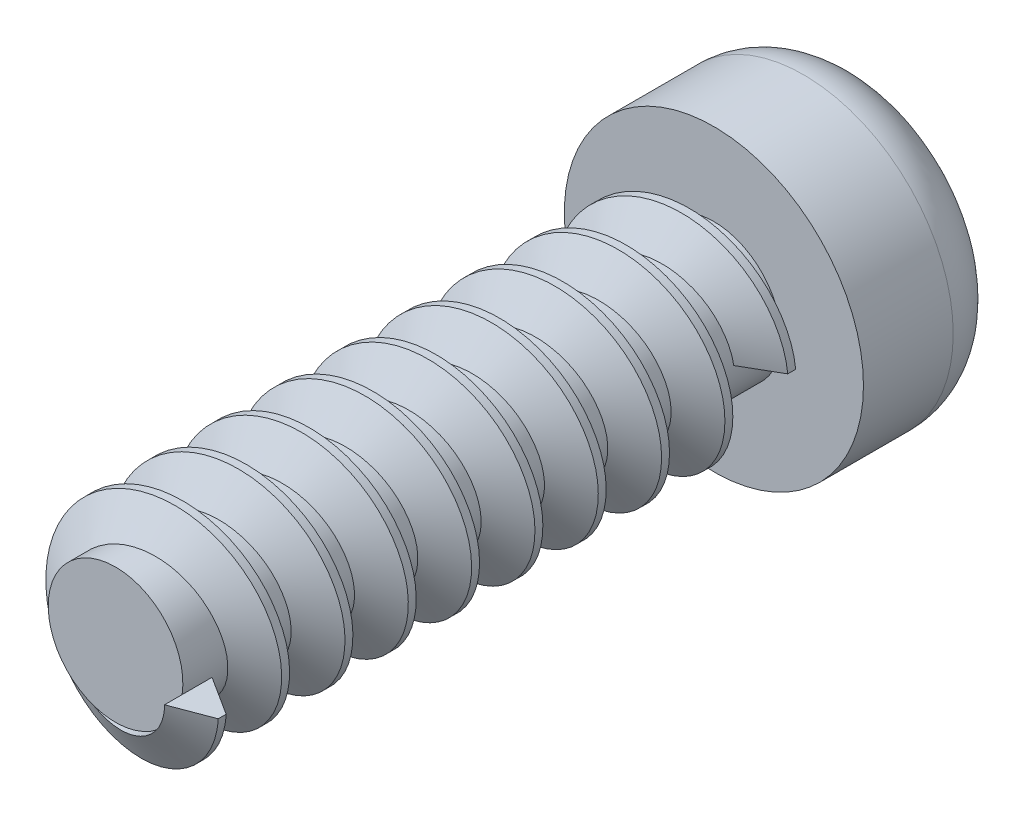
from build123d import *

# Parameters (mm, degrees)
SKETCH1_R           = 5
BOSS_EXTRUDE1_DEPTH = 5
SKETCH2_R           = 2.25
BOSS_EXTRUDE2_DEPTH = 20
THREAD1_PITCH       = 2.116666667
FILLET1_R           = 2


with BuildPart() as part:
    # Sketch1 → Boss-Extrude1 (new body)
    with BuildSketch(Plane.XY):
        Circle(SKETCH1_R)
    extrude(amount=BOSS_EXTRUDE1_DEPTH)

    # Sketch2 → Boss-Extrude2 (add)
    with BuildSketch(Plane.XY.offset(5)):
        Circle(SKETCH2_R)
    extrude(amount=BOSS_EXTRUDE2_DEPTH)

    # Thread1: the profile of Thread Profile1 profile screwed along a right-hand helix of 8.976378 turns, 10 arcs to a turn; built about Z, then put on its axis
    thread1_z = Axis((0, 0, 0), (0, 0, 1))
    thread1_corners = [(2.2497, 0, -0.000173205), (3.395679435, 0, 0.66145833), (3.395679435, 0, 0.926041664), (2.2497, 0, 1.587673199)]
    with BuildLine(mode=Mode.PRIVATE) as thread1_profile:
        Line(thread1_corners[0], thread1_corners[1])
        Line(thread1_corners[1], thread1_corners[2])
        Line(thread1_corners[2], thread1_corners[3])
        Line(thread1_corners[3], thread1_corners[0])
    thread1_cap = Face(thread1_profile.wire())
    thread1_turn_angles = [0, 18, 36, 54, 72, 90, 108, 126, 144, 162, 180, 198, 216, 234, 252, 270, 288, 306, 324, 342, 360]
    thread1_turn_weights = [1, 0.9510565162951535, 1, 0.9510565162951535, 1, 0.9510565162951535, 1, 0.9510565162951535, 1, 0.9510565162951535, 1, 0.9510565162951535, 1, 0.9510565162951535, 1, 0.9510565162951535, 1, 0.9510565162951535, 1, 0.9510565162951535, 1]
    thread1_turn_rails = [Edge.make_bspline([Vector(p[0], p[1], 0).rotate(thread1_z, thread1_turn_angles[k]) / thread1_turn_weights[k] + Vector(0, 0, p[2] + THREAD1_PITCH * thread1_turn_angles[k] / 360) for k in range(21)], [0, 0, 0, 1, 1, 2, 2, 3, 3, 4, 4, 5, 5, 6, 6, 7, 7, 8, 8, 9, 9, 10, 10, 10], 2, thread1_turn_weights) for p in thread1_corners]
    thread1_turn_sides = [Face.make_surface_from_curves(thread1_turn_rails[p[0]], thread1_turn_rails[p[1]]) for p in [(0, 1), (1, 2), (2, 3), (3, 0)]]
    thread1_last_angles = [2880, 2898, 2916, 2934, 2952, 2970, 2988, 3006, 3024, 3042, 3060, 3078, 3096, 3114, 3132, 3150, 3168, 3186, 3204, 3217.748031496, 3231.496062992]
    thread1_last_weights = [1, 0.9510565162951535, 1, 0.9510565162951535, 1, 0.9510565162951535, 1, 0.9510565162951535, 1, 0.9510565162951535, 1, 0.9510565162951535, 1, 0.9510565162951535, 1, 0.9510565162951535, 1, 0.9510565162951535, 1, 0.9713502353844763, 1]
    thread1_last_rails = [Edge.make_bspline([Vector(p[0], p[1], 0).rotate(thread1_z, thread1_last_angles[k]) / thread1_last_weights[k] + Vector(0, 0, p[2] + THREAD1_PITCH * thread1_last_angles[k] / 360) for k in range(21)], [0, 0, 0, 1, 1, 2, 2, 3, 3, 4, 4, 5, 5, 6, 6, 7, 7, 8, 8, 9, 9, 10, 10, 10], 2, thread1_last_weights) for p in thread1_corners]
    thread1_last_sides = [Face.make_surface_from_curves(thread1_last_rails[p[0]], thread1_last_rails[p[1]]) for p in [(0, 1), (1, 2), (2, 3), (3, 0)]]
    thread1 = Plane(origin=(0, 0, 5), x_dir=(1, 0, 0), z_dir=(0, 0, 1)) * Solid(Shell([*[p.moved(Location((0, 0, THREAD1_PITCH * i))) for i in range(8) for p in thread1_turn_sides], *thread1_last_sides, thread1_cap, thread1_cap.rotate(thread1_z, 3231.496062992).moved(Location((0, 0, THREAD1_PITCH * 3231.496062992 / 360)))]))
    add(thread1)

    # Fillet1
    fillet1_edges = [part.edges().sort_by_distance(p)[0] for p in [
        (-5, 0, 0),
    ]]
    fillet(fillet1_edges, radius=FILLET1_R)


solid = part.part
